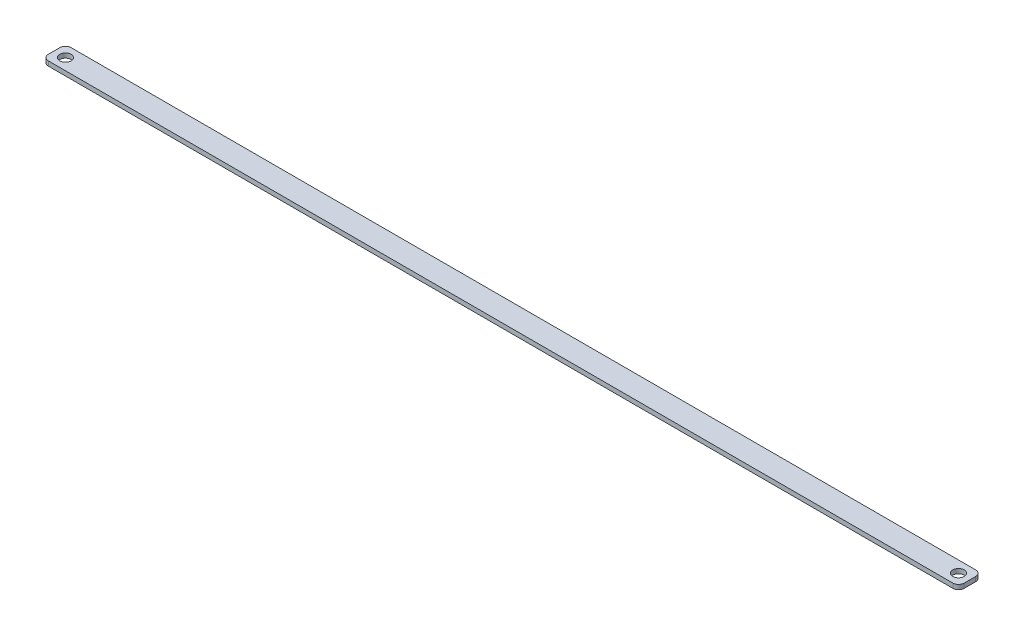
from build123d import *

# Parameters (mm, degrees)
SKETCH1_R           = 2.5
BOSS_EXTRUDE2_DEPTH = 2
FLEX1_OUTLINE_R     = 2.5
FLEX1_DEPTH         = 2


# Read off the part's stored shape, not the designer's step: Flex1
with BuildPart() as part:
    # Sketch1 → Boss-Extrude2 (new body)
    with BuildSketch(Plane(origin=(0, 0, 0), x_dir=(1, 0, 0), z_dir=(0, 1, 0))):
        with BuildLine():
            Line((2.5, 0), (47.5, 0))
            ThreePointArc((47.5, 0), (49.267766953, 0.732233047), (50, 2.5))
            Line((50, 2.5), (50, 7.5))
            ThreePointArc((50, 7.5), (49.267766953, 9.267766953), (47.5, 10))
            Line((47.5, 10), (2.5, 10))
            ThreePointArc((2.5, 10), (0.732233047, 9.267766953), (0, 7.5))
            Line((0, 7.5), (0, 2.5))
            ThreePointArc((0, 2.5), (0.732233047, 0.732233047), (2.5, 0))
        make_face()
        with Locations(Location((5, 5, 0), (0, 0, 270))):
            Circle(SKETCH1_R, mode=Mode.SUBTRACT)
        with Locations(Location((45, 5, 0), (0, 0, 270))):
            Circle(SKETCH1_R, mode=Mode.SUBTRACT)
    extrude(amount=BOSS_EXTRUDE2_DEPTH)

    # Flex1 outline → Flex1 (add)
    # profile 1 of 4: a face of its own
    with BuildSketch(Plane(origin=(0, 0, 0), x_dir=(1, 0, 0), z_dir=(0, 1, 0))):
        with BuildLine():
            Line((2.5, 10), (-168.76171244, 10))
            ThreePointArc((-168.76171244, 10), (-170.529479393, 9.267766953), (-171.26171244, 7.5))
            Line((-171.26171244, 7.5), (-171.26171244, 2.5))
            ThreePointArc((-171.26171244, 2.5), (-170.529479393, 0.732233047), (-168.76171244, 0))
            Line((-168.76171244, 0), (2.5, 0))
            ThreePointArc((2.5, 0), (0.732233047, 0.732233047), (0, 2.5))
            Line((0, 2.5), (0, 7.5))
            ThreePointArc((0, 7.5), (0.732233047, 9.267766953), (2.5, 10))
        make_face()
        with Locations((-166.26171244, 5)):
            Circle(FLEX1_OUTLINE_R, mode=Mode.SUBTRACT)
    # profile 2 of 4: a face of its own
    with BuildSketch(Plane(origin=(0, 0, 0), x_dir=(1, 0, 0), z_dir=(0, 1, 0))):
        with BuildLine():
            Line((227.23828756, 10), (47.5, 10))
            ThreePointArc((47.5, 10), (49.267766953, 9.267766953), (50, 7.5))
            Line((50, 7.5), (50, 2.5))
            ThreePointArc((50, 2.5), (49.267766953, 0.732233047), (47.5, 0))
            Line((47.5, 0), (227.23828756, 0))
            ThreePointArc((227.23828756, 0), (229.006054513, 0.732233047), (229.73828756, 2.5))
            Line((229.73828756, 2.5), (229.73828756, 7.5))
            ThreePointArc((229.73828756, 7.5), (229.006054513, 9.267766953), (227.23828756, 10))
        make_face()
        with Locations((224.73828756, 5)):
            Circle(FLEX1_OUTLINE_R, mode=Mode.SUBTRACT)
    # profile 3 of 4: a face of its own
    with BuildSketch(Plane(origin=(0, 0, 0), x_dir=(1, 0, 0), z_dir=(0, 1, 0))):
        with Locations((5, 5)):
            Circle(FLEX1_OUTLINE_R)
    # profile 4 of 4: a face of its own
    with BuildSketch(Plane(origin=(0, 0, 0), x_dir=(1, 0, 0), z_dir=(0, 1, 0))):
        with Locations((45, 5)):
            Circle(FLEX1_OUTLINE_R)
    extrude(amount=FLEX1_DEPTH)


solid = part.part
